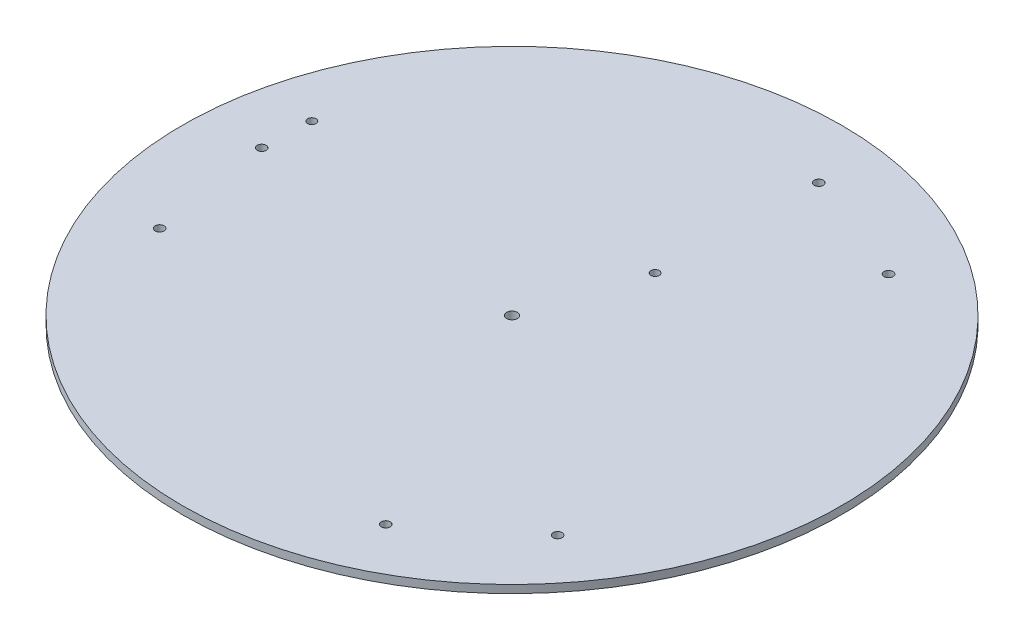
from build123d import *

# Parameters (mm, degrees)
SKETCH2_R               = 125
BOSS_EXTRUDE1_DEPTH     = 3
CUT_EXTRUDE1_DEPTH      = 62
CUT_EXTRUDE1_DEPTH_BACK = 26
SKETCH3_R               = 1.7
CUT_EXTRUDE2_DEPTH      = 55
CUT_EXTRUDE2_DEPTH_BACK = 33
SKETCH4_R               = 2.05
SKETCH5_R               = 1.6
CUT_EXTRUDE3_DEPTH      = 177.802149308


with BuildPart() as part:
    # Sketch2 → Boss-Extrude1 (new body)
    with BuildSketch(Plane(origin=(0, 0, 0), x_dir=(1, 0, 0), z_dir=(0, 1, 0))):
        Circle(SKETCH2_R)
    extrude(amount=BOSS_EXTRUDE1_DEPTH)

    # Sketch3 → Cut-Extrude1 (cut, two sides: drawn at the far end of the back side and taken through both)
    with BuildSketch(Plane(origin=(0, 3, 0), x_dir=(1, 0, 0), z_dir=(0, 1, 0)).offset(-CUT_EXTRUDE1_DEPTH_BACK)):
        with Locations((57.824361976, 84.994428132)):
            Circle(SKETCH3_R)
        with Locations((14.606066285, 101.75643704)):
            Circle(SKETCH3_R)
        with Locations((44.695152955, -92.574580495)):
            Circle(SKETCH3_R)
        with Locations((80.820626333, -63.527442972)):
            Circle(SKETCH3_R)
        with Locations((-102.519514931, 7.580152362)):
            Circle(SKETCH3_R)
        with Locations((-95.426692618, -38.228994068)):
            Circle(SKETCH3_R)
    extrude(amount=CUT_EXTRUDE1_DEPTH + CUT_EXTRUDE1_DEPTH_BACK, mode=Mode.SUBTRACT)

    # Sketch4 → Cut-Extrude2 (cut, two sides: drawn at the far end of the back side and taken through both)
    with BuildSketch(Plane(origin=(0, 3, 0), x_dir=(1, 0, 0), z_dir=(0, 1, 0)).offset(-CUT_EXTRUDE2_DEPTH_BACK)):
        Circle(SKETCH4_R)
    extrude(amount=CUT_EXTRUDE2_DEPTH + CUT_EXTRUDE2_DEPTH_BACK, mode=Mode.SUBTRACT)

    # Sketch5 → Cut-Extrude3 (cut, through all)
    with BuildSketch(Plane.XZ):
        with Locations((-101.778099897, -25.854755487)):
            Circle(SKETCH5_R)
        with Locations((13.216774043, -41.092175458)):
            Circle(SKETCH5_R)
    extrude(amount=-CUT_EXTRUDE3_DEPTH, mode=Mode.SUBTRACT)


solid = part.part
